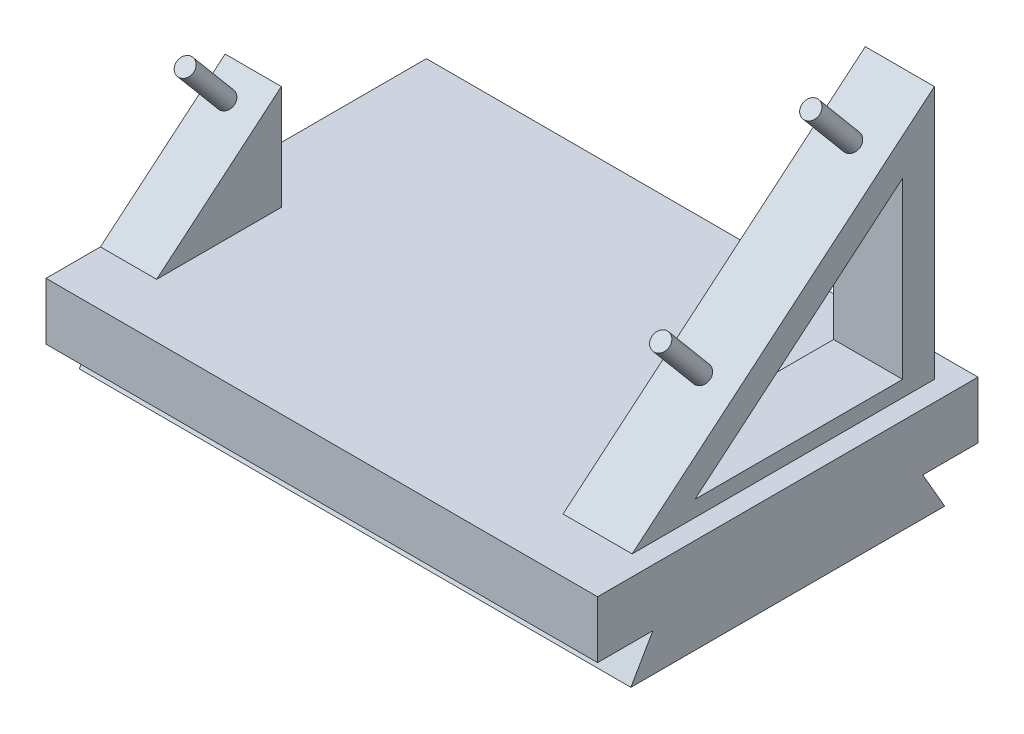
from build123d import *

# Parameters (mm, degrees)
SKETCH1_W              = 196
SKETCH1_H              = 150
BOSS_EXTRUDE1_DEPTH    = 15
SKETCH2_W              = 166
SKETCH2_H              = 55
CUT_EXTRUDE1_DEPTH     = 9.68
SKETCH3_R              = 1.5
BOSS_EXTRUDE2_DEPTH    = 10
SKETCH4_W              = 10.9
SKETCH4_H              = 64
BOSS_EXTRUDE3_DEPTH    = 40
CUT_EXTRUDE2_DEPTH     = 109
SKETCH6_R              = 1.4
SKETCH6_R_2            = 1.375
BOSS_EXTRUDE4_DEPTH    = 10
FILLET1_R              = 10
CUT_EXTRUDE4_START     = -15
CUT_EXTRUDE4_OUTLINE_R = 1.5
CUT_EXTRUDE4_DEPTH     = 15
SKETCH10_W             = 60
SKETCH10_H             = 37
CUT_EXTRUDE5_DEPTH     = 83
SKETCH11_W             = 10
SKETCH11_H             = 52.5
CUT_EXTRUDE6_DEPTH     = 36
SKETCH13_W             = 28
SKETCH13_H             = 42.5
CUT_EXTRUDE7_DEPTH     = 19
SKETCH19_W             = 4
SKETCH19_H             = 55
SKETCH19_W_2           = 2.77
SKETCH19_H_2           = 50
CUT_EXTRUDE9_DEPTH     = 76
SKETCH21_W             = 86.997648927
SKETCH21_H             = 15
BOSS_EXTRUDE6_DEPTH    = 3.75
SKETCH22_W             = 86.997648927
SKETCH22_H             = 15
BOSS_EXTRUDE7_DEPTH    = 3.75
CUT_EXTRUDE11_DEPTH    = 94.75
CUT_EXTRUDE12_DEPTH    = 16


# Read off the part's stored shape, not the designer's step: Cut-Extrude4
with BuildPart() as part:
    # Sketch1 → Boss-Extrude1 (new body)
    with BuildSketch(Plane(origin=(0, 0, 0), x_dir=(1, 0, 0), z_dir=(0, 1, 0))):
        with Locations((98, 75)):
            Rectangle(SKETCH1_W, SKETCH1_H)
    extrude(amount=BOSS_EXTRUDE1_DEPTH)

    # Sketch2 → Cut-Extrude1 (cut)
    with BuildSketch(Plane(origin=(0, 15, 0), x_dir=(1, 0, 0), z_dir=(0, 1, 0))):
        with Locations((98, 42.5)):
            Rectangle(SKETCH2_W, SKETCH2_H)
    extrude(amount=-CUT_EXTRUDE1_DEPTH, mode=Mode.SUBTRACT)

    # Sketch3 → Boss-Extrude2 (add)
    with BuildSketch(Plane(origin=(0, 15, 0), x_dir=(1, 0, 0), z_dir=(0, 1, 0))):
        with Locations(Location((25, 133.2, 0), (0, 0, 90))):
            Circle(SKETCH3_R)
        with Locations(Location((23.7, 85, 0), (0, 0, 90))):
            Circle(SKETCH3_R)
        with Locations(Location((75.8, 118, 0), (0, 0, 90))):
            Circle(SKETCH3_R)
        with Locations(Location((75.8, 90.1, 0), (0, 0, 90))):
            Circle(SKETCH3_R)
    extrude(amount=BOSS_EXTRUDE2_DEPTH)

    # Sketch4 → Boss-Extrude3 (add)
    with BuildSketch(Plane(origin=(0, 15, 0), x_dir=(1, 0, 0), z_dir=(0, 1, 0))):
        with Locations((99.65, 108)):
            Rectangle(SKETCH4_W, SKETCH4_H)
        with Locations((174.65, 108)):
            Rectangle(SKETCH4_W, SKETCH4_H)
    extrude(amount=BOSS_EXTRUDE3_DEPTH)

    # Sketch5 → Cut-Extrude2 (cut)
    with BuildSketch(Plane(origin=(196, 0, 0), x_dir=(0, 0, -1), z_dir=(1, 0, 0))):
        Polygon((140, 55), (92.329856296, 15), (75, 15), (75, 55), align=None)
    extrude(amount=-CUT_EXTRUDE2_DEPTH, mode=Mode.SUBTRACT)

    # Sketch6 → Boss-Extrude4 (add)
    with BuildSketch(Plane(origin=(0, -36.661217825, -30.762414355), x_dir=(1, 0, 0), z_dir=(0, 0.7660444431189771, 0.6427876096865404))):
        with Locations(Location((174.7, 132.599540569, 0), (0, 0, 90))):
            Circle(SKETCH6_R)
        with Locations(Location((174.7, 101.689540569, 0), (0, 0, 90))):
            Circle(SKETCH6_R)
        with Locations(Location((99.7, 132.599540569, 0), (0, 0, 90))):
            Circle(SKETCH6_R_2)
        with Locations(Location((99.7, 101.689540569, 0), (0, 0, 90))):
            Circle(SKETCH6_R_2)
    extrude(amount=BOSS_EXTRUDE4_DEPTH)

    # Fillet1
    fillet1_edges = [part.edges().sort_by_distance(p)[0] for p in [
        (196, 15, -75),
        (98, 15, -150),
        (0, 15, -75),
        (98, 15, 0),
    ]]
    fillet(fillet1_edges, radius=FILLET1_R - 0.0001)  # a hair under: the kernel refuses the full size

    # Cut-Extrude4 outline → Cut-Extrude4 (cut)
    with BuildSketch(Plane(origin=(0, 15, 0), x_dir=(1, 0, 0), z_dir=(0, 1, 0)).offset(CUT_EXTRUDE4_START)):
        Polygon((92.232351073, 87.5), (92.232351073, 140), (196, 140), (196, 150), (0, 150), (0, 0), (196, 0), (196, 87.5), align=None)
        with Locations((23.7, 85)):
            Circle(CUT_EXTRUDE4_OUTLINE_R, mode=Mode.SUBTRACT)
        with Locations((75.8, 90.1)):
            Circle(CUT_EXTRUDE4_OUTLINE_R, mode=Mode.SUBTRACT)
        with Locations((25, 133.2)):
            Circle(CUT_EXTRUDE4_OUTLINE_R, mode=Mode.SUBTRACT)
        with Locations((75.8, 118)):
            Circle(CUT_EXTRUDE4_OUTLINE_R, mode=Mode.SUBTRACT)
    extrude(amount=CUT_EXTRUDE4_DEPTH, mode=Mode.SUBTRACT)

    # Sketch10 → Cut-Extrude5 (cut)
    with BuildSketch(Plane.ZY.offset(-92.232351073)):
        with Locations((-110, 18.5)):
            Rectangle(SKETCH10_W, SKETCH10_H)
    extrude(amount=CUT_EXTRUDE5_DEPTH, mode=Mode.SUBTRACT)

    # Sketch11 → Cut-Extrude6 (cut)
    with BuildSketch(Plane(origin=(0, 15, 0), x_dir=(1, 0, 0), z_dir=(0, 1, 0))):
        with Locations((191, 113.75)):
            Rectangle(SKETCH11_W, SKETCH11_H)
    extrude(amount=-CUT_EXTRUDE6_DEPTH, mode=Mode.SUBTRACT)

    # Sketch13 → Cut-Extrude7 (cut)
    with BuildSketch(Plane.ZY.offset(-92.232351073)):
        with Locations((-126, 36.25)):
            Rectangle(SKETCH13_W, SKETCH13_H)
    extrude(amount=-CUT_EXTRUDE7_DEPTH, mode=Mode.SUBTRACT)

    # Sketch19 → Cut-Extrude9 (cut)
    with BuildSketch(Plane.XY.offset(-87.5)):
        with Locations((94.232351073, 27.5)):
            Rectangle(SKETCH19_W, SKETCH19_H)
        with Locations((184.615, 25)):
            Rectangle(SKETCH19_W_2, SKETCH19_H_2)
    extrude(amount=-CUT_EXTRUDE9_DEPTH, mode=Mode.SUBTRACT)

    # Sketch21 → Boss-Extrude6 (add)
    with BuildSketch(Plane(origin=(0, 0, -140), x_dir=(-1, 0, 0), z_dir=(0, 0, -1))):
        with Locations((-139.731175537, 7.5)):
            Rectangle(SKETCH21_W, SKETCH21_H)
    extrude(amount=BOSS_EXTRUDE6_DEPTH)

    # Sketch22 → Boss-Extrude7 (add)
    with BuildSketch(Plane.XY.offset(-87.5)):
        with Locations((139.731175537, 7.5)):
            Rectangle(SKETCH22_W, SKETCH22_H)
    extrude(amount=BOSS_EXTRUDE7_DEPTH)

    # Sketch23 → Cut-Extrude11 (cut)
    with BuildSketch(Plane.ZY.offset(-96.232351073)):
        Polygon((-143.75, 6), (-135.035898385, 6), (-138.5, 0), (-143.75, 0), align=None)
        Polygon((-83.75, 0), (-83.75, 6), (-92.464101615, 6), (-89, 0), align=None)
    extrude(amount=-CUT_EXTRUDE11_DEPTH, mode=Mode.SUBTRACT)

    # Sketch24 → Cut-Extrude12 (cut)
    with BuildSketch(Plane(origin=(180.1, 0, 0), x_dir=(0, 0, -1), z_dir=(1, 0, 0))):
        Polygon((135, 45), (102.226776204, 17.5), (135, 17.5), align=None)
    extrude(amount=-CUT_EXTRUDE12_DEPTH, mode=Mode.SUBTRACT)


solid = part.part
